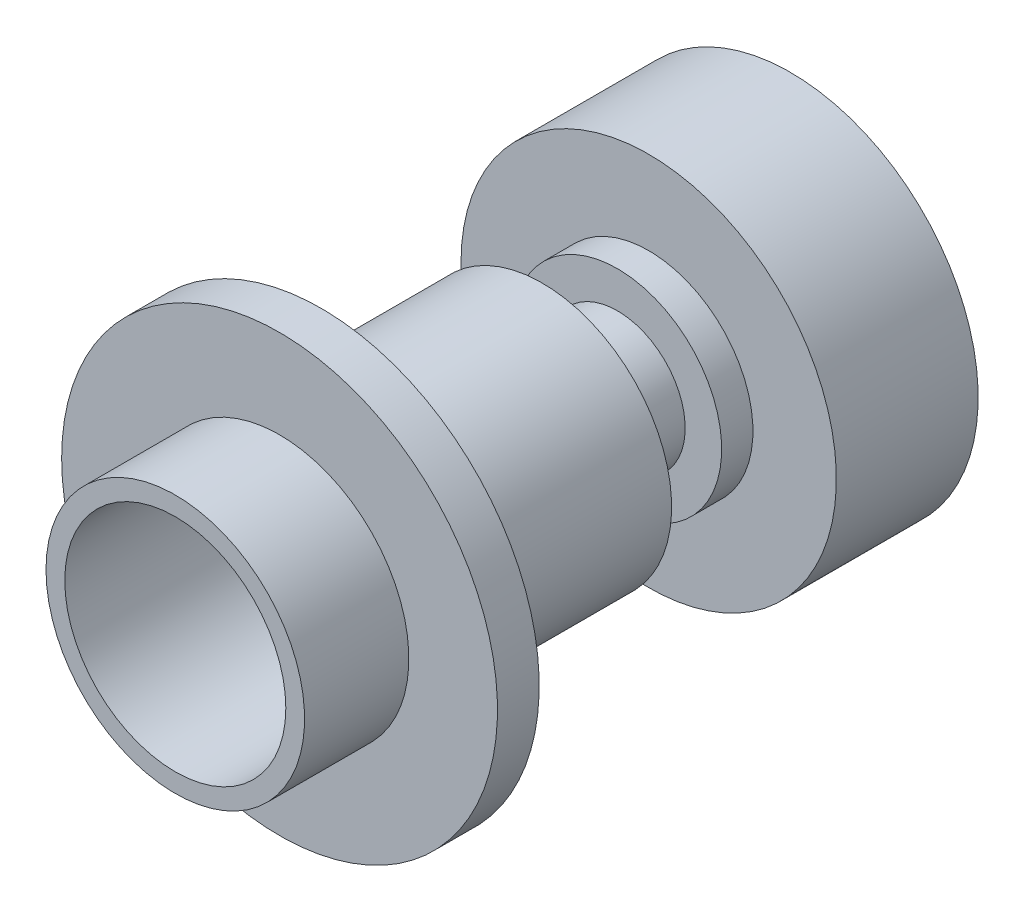
from build123d import *


with BuildPart() as part:
    # Body Sketch → Body Revolve (revolve)
    with BuildSketch(Plane(origin=(0, 0, 0), x_dir=(1, 0, 0), z_dir=(0, 1, 0))):
        Polygon((2.65, -14.75), (3.1, -14.75), (3.1, -12.25), (5.225, -12.25), (5.225, -11.25), (3.1, -11.25), (3.1, -5.95), (1.625, -5.55), (1.625, -4.15), (2.5, -4.15), (2.5, -3.4), (0.25, -3.4), (0.25, -5.954207714), (2.65, -6.605055172), align=None)
    revolve(axis=Axis((0, 0, 0), (0, 0, 1)))

    # N75 Sketch → N75 Revolve (revolve)
    with BuildSketch(Plane(origin=(0, 0, 0), x_dir=(1, 0, 0), z_dir=(0, 1, 0))):
        Polygon((3.75, 0), (4.5, 0), (4.5, -3.4), (0.8, -3.4), (0.8, -2.65), (3.75, -2.65), align=None)
    revolve(axis=Axis((0, 0, 0), (0, 0, 1)))


solid = part.part
